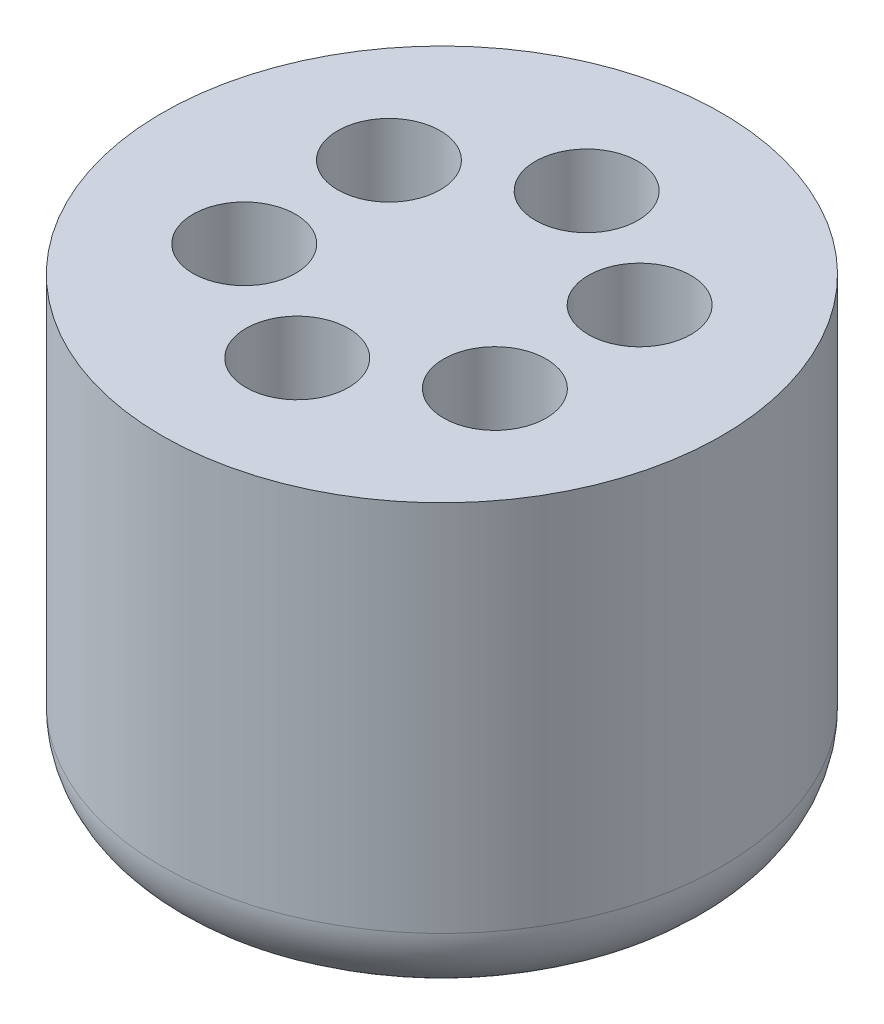
from build123d import *

# Parameters (mm, degrees)
SKETCH1_R           = 30
BOSS_EXTRUDE1_DEPTH = 48
SKETCH2_R           = 5.5
CUT_EXTRUDE1_DEPTH  = 32
FILLET1_R           = 8
SKETCH2_3_R         = 5.5
CUT_EXTRUDE2_DEPTH  = 35


with BuildPart() as part:
    # Sketch1 → Boss-Extrude1 (new body)
    with BuildSketch(Plane(origin=(0, 0, 0), x_dir=(1, 0, 0), z_dir=(0, 1, 0))):
        Circle(SKETCH1_R)
    extrude(amount=BOSS_EXTRUDE1_DEPTH)

    # Sketch2 → Cut-Extrude1 (cut)
    with BuildSketch(Plane(origin=(0, 48, 0), x_dir=(1, 0, 0), z_dir=(0, 1, 0))):
        with Locations((0, 15.52)):
            Circle(SKETCH2_R)
        with Locations((-13.440714267, 7.76)):
            Circle(SKETCH2_R)
        with Locations((-13.440714267, -7.76)):
            Circle(SKETCH2_R)
        with Locations((0, -15.52)):
            Circle(SKETCH2_R)
        with Locations((13.440714267, -7.76)):
            Circle(SKETCH2_R)
        with Locations((13.440714267, 7.76)):
            Circle(SKETCH2_R)
    extrude(amount=-CUT_EXTRUDE1_DEPTH, mode=Mode.SUBTRACT)

    # Fillet1
    fillet1_edges = [part.edges().sort_by_distance(p)[0] for p in [
        (-30, 0, 0),
    ]]
    fillet(fillet1_edges, radius=FILLET1_R)

    # Sketch2<3> → Cut-Extrude2 (cut)
    with BuildSketch(Plane(origin=(0, 48, 0), x_dir=(1, 0, 0), z_dir=(0, 1, 0))):
        with Locations((0, 15.52)):
            Circle(SKETCH2_3_R)
        with Locations((-13.440714267, 7.76)):
            Circle(SKETCH2_3_R)
        with Locations((-13.440714267, -7.76)):
            Circle(SKETCH2_3_R)
        with Locations((0, -15.52)):
            Circle(SKETCH2_3_R)
        with Locations((13.440714267, -7.76)):
            Circle(SKETCH2_3_R)
        with Locations((13.440714267, 7.76)):
            Circle(SKETCH2_3_R)
    extrude(amount=-CUT_EXTRUDE2_DEPTH, mode=Mode.SUBTRACT)


solid = part.part
